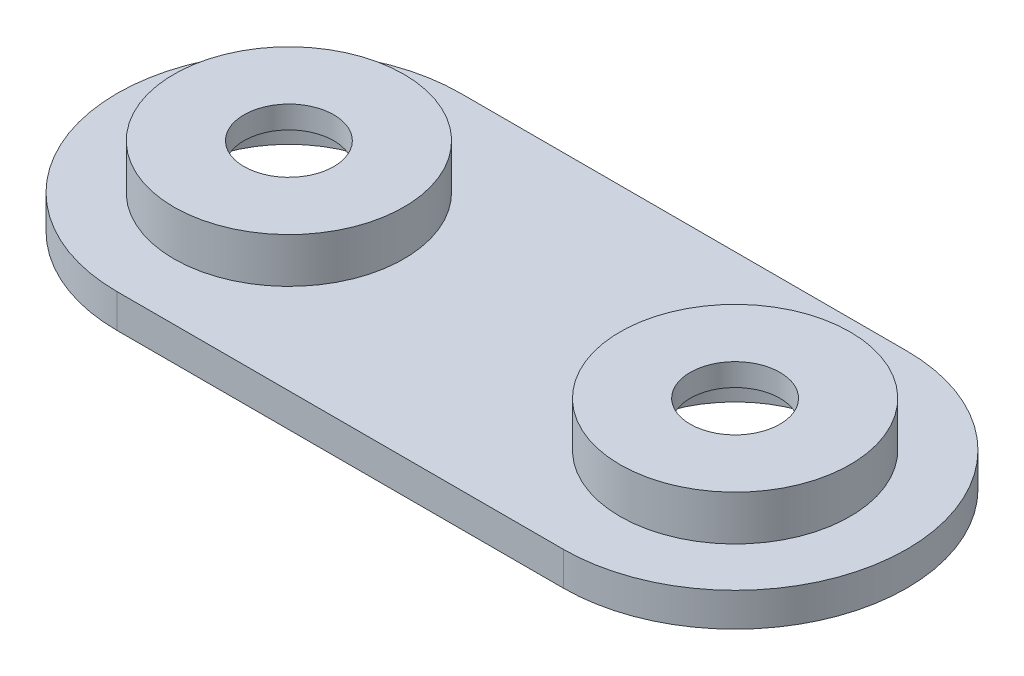
from build123d import *

# Parameters (mm, degrees)
BOSS_EXTRUDE1_DEPTH = 3
SKETCH2_R           = 9.5
CUT_EXTRUDE1_DEPTH  = 47.732818672
BOSS_EXTRUDE2_START = 2
SKETCH3_R           = 10.25
SKETCH3_R_2         = 9.5
BOSS_EXTRUDE2_DEPTH = 2
BOSS_EXTRUDE3_START = 2
SKETCH4_R           = 10.25
BOSS_EXTRUDE3_DEPTH = 2
SKETCH5_R           = 4
CUT_EXTRUDE2_DEPTH  = 2


with BuildPart() as part:
    # Sketch1 → Boss-Extrude1 (new body)
    with BuildSketch(Plane(origin=(0, 0, 0), x_dir=(1, 0, 0), z_dir=(0, 1, 0))):
        with BuildLine():
            Line((19.879152095, 0), (-19.879152095, 0))
            ThreePointArc((-19.879152095, 0), (-35.184461635, -15.30530954), (-19.879152095, -30.61061908))
            Line((-19.879152095, -30.61061908), (19.879152095, -30.61061908))
            ThreePointArc((19.879152095, -30.61061908), (35.184461635, -15.30530954), (19.879152095, 0))
        make_face()
    extrude(amount=BOSS_EXTRUDE1_DEPTH)

    # Sketch2 → Cut-Extrude1 (cut, through all)
    with BuildSketch(Plane(origin=(0, 3, 0), x_dir=(1, 0, 0), z_dir=(0, 1, 0))):
        with Locations((-19.879152095, -15.30530954)):
            Circle(SKETCH2_R)
        with Locations((19.879152095, -15.30530954)):
            Circle(SKETCH2_R)
    extrude(amount=-CUT_EXTRUDE1_DEPTH, mode=Mode.SUBTRACT)

    # Sketch3 → Boss-Extrude2 (add)
    # profile 1 of 2: a face of its own
    with BuildSketch(Plane(origin=(0, 3, 0), x_dir=(1, 0, 0), z_dir=(0, 1, 0)).offset(BOSS_EXTRUDE2_START)):
        with Locations((19.879152095, -15.30530954)):
            Circle(SKETCH3_R)
        with Locations((19.879152095, -15.30530954)):
            Circle(SKETCH3_R_2, mode=Mode.SUBTRACT)
    # profile 2 of 2: a face of its own
    with BuildSketch(Plane(origin=(0, 3, 0), x_dir=(1, 0, 0), z_dir=(0, 1, 0)).offset(BOSS_EXTRUDE2_START)):
        with Locations((-19.879152095, -15.30530954)):
            Circle(SKETCH3_R)
        with Locations((-19.879152095, -15.30530954)):
            Circle(SKETCH3_R_2, mode=Mode.SUBTRACT)
    extrude(amount=-BOSS_EXTRUDE2_DEPTH)

    # Sketch4 → Boss-Extrude3 (add)
    with BuildSketch(Plane(origin=(0, 5, 0), x_dir=(1, 0, 0), z_dir=(0, 1, 0)).offset(BOSS_EXTRUDE3_START)):
        with Locations((19.879152095, -15.30530954)):
            Circle(SKETCH4_R)
        with Locations((-19.879152095, -15.30530954)):
            Circle(SKETCH4_R)
    extrude(amount=-BOSS_EXTRUDE3_DEPTH)

    # Sketch5 → Cut-Extrude2 (cut)
    with BuildSketch(Plane(origin=(0, 7, 0), x_dir=(1, 0, 0), z_dir=(0, 1, 0))):
        with Locations((19.879152095, -15.30530954)):
            Circle(SKETCH5_R)
        with Locations((-19.879152095, -15.30530954)):
            Circle(SKETCH5_R)
    extrude(amount=-CUT_EXTRUDE2_DEPTH, mode=Mode.SUBTRACT)


solid = part.part
